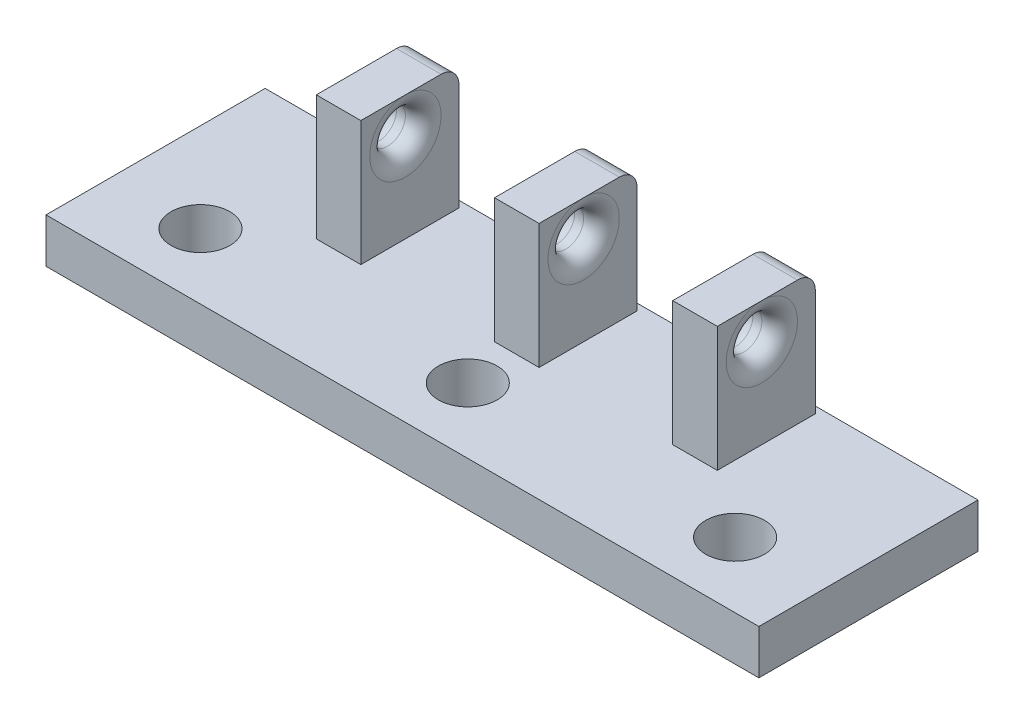
from build123d import *

# Parameters (mm, degrees)
SKETCH1_W           = 40
SKETCH1_H           = 29.333333334
SKETCH1_R           = 1.65
BOSS_EXTRUDE1_DEPTH = 2.5
SKETCH2_W           = 2.5
SKETCH2_H           = 5.5
BOSS_EXTRUDE2_DEPTH = 7
CUT_EXTRUDE1_REACH  = 37.804
SKETCH3_R           = 1
FILLET1_R           = 1
FILLET2_R           = 1
CUT_EXTRUDE2_REACH  = 27.77
SKETCH4_W           = 40
SKETCH4_H           = 17.038815724


with BuildPart() as part:
    # Sketch1 → Boss-Extrude1 (new body)
    with BuildSketch(Plane(origin=(0, 0, 0), x_dir=(1, 0, 0), z_dir=(0, 1, 0))):
        Rectangle(SKETCH1_W, SKETCH1_H)
        with Locations(Location((-15, 11, 0), (0, 0, 270))):
            Circle(SKETCH1_R, mode=Mode.SUBTRACT)
        with Locations(Location((0, 11, 0), (0, 0, 270))):
            Circle(SKETCH1_R, mode=Mode.SUBTRACT)
        with Locations(Location((15, 11, 0), (0, 0, 270))):
            Circle(SKETCH1_R, mode=Mode.SUBTRACT)
        with Locations(Location((0, 0, 0), (0, 0, 270))):
            Circle(SKETCH1_R, mode=Mode.SUBTRACT)
        with Locations(Location((15, 0, 0), (0, 0, 270))):
            Circle(SKETCH1_R, mode=Mode.SUBTRACT)
        with Locations(Location((0, -11, 0), (0, 0, 270))):
            Circle(SKETCH1_R, mode=Mode.SUBTRACT)
        with Locations(Location((15, -11, 0), (0, 0, 270))):
            Circle(SKETCH1_R, mode=Mode.SUBTRACT)
        with Locations(Location((-15, 0, 0), (0, 0, 270))):
            Circle(SKETCH1_R, mode=Mode.SUBTRACT)
        with Locations(Location((-15, -11, 0), (0, 0, 270))):
            Circle(SKETCH1_R, mode=Mode.SUBTRACT)
    extrude(amount=BOSS_EXTRUDE1_DEPTH)

    # Sketch2 → Boss-Extrude2 (add)
    with BuildSketch(Plane(origin=(0, 2.5, 0), x_dir=(1, 0, 0), z_dir=(0, 1, 0))):
        with Locations((10, -5.5)):
            Rectangle(SKETCH2_W, SKETCH2_H)
        with Locations((0, -5.5)):
            Rectangle(SKETCH2_W, SKETCH2_H)
        with Locations((-10, -5.5)):
            Rectangle(SKETCH2_W, SKETCH2_H)
    extrude(amount=BOSS_EXTRUDE2_DEPTH)

    # Cut-Extrude1: up to this face of the body (flat: up to its plane)
    cut_extrude1_end = Plane(part.part.faces().sort_by_distance((-11.25, 6, 5.5))[0])
    # Sketch3 → Cut-Extrude1 (cut, up to the picked face)
    with BuildSketch(Plane(origin=(11.25, 0, 0), x_dir=(0, 0, -1), z_dir=(1, 0, 0)), mode=Mode.PRIVATE) as cut_extrude1_sk1:
        with Locations((-5.75, 7.5)):
            Circle(SKETCH3_R)
    cut_extrude1_tool1 = split(extrude(cut_extrude1_sk1.sketch, amount=-CUT_EXTRUDE1_REACH, mode=Mode.PRIVATE), bisect_by=cut_extrude1_end, keep=Keep.BOTH, mode=Mode.PRIVATE)
    add(cut_extrude1_tool1.solids().sort_by(Axis((11.25, 7.5, 5.75), (-1, 0, 0)))[0], mode=Mode.SUBTRACT)

    # Fillet1
    fillet1_edges = [part.edges().sort_by_distance(p)[0] for p in [
        (-1.25, 7.5, 6.75),
        (1.25, 7.5, 6.75),
        (8.75, 7.5, 6.75),
        (-8.75, 7.5, 6.75),
        (11.25, 7.5, 6.75),
        (-11.25, 7.5, 6.75),
    ]]
    fillet(fillet1_edges, radius=FILLET1_R - 0.0001)  # a hair under: the kernel refuses the full size

    # Fillet2
    fillet2_edges = [part.edges().sort_by_distance(p)[0] for p in [
        (0, 9.5, 2.75),
        (10, 9.5, 2.75),
        (-10, 9.5, 2.75),
    ]]
    fillet(fillet2_edges, radius=FILLET2_R)

    # Sketch4 → Cut-Extrude2 (cut, up to next)
    with BuildSketch(Plane(origin=(0, 2.5, 0), x_dir=(1, 0, 0), z_dir=(0, 1, 0)), mode=Mode.PRIVATE) as cut_extrude2_sk1:
        with Locations((0, 6.147258805)):
            Rectangle(SKETCH4_W, SKETCH4_H)
    cut_extrude2_tool1 = extrude(cut_extrude2_sk1.sketch, amount=-CUT_EXTRUDE2_REACH, mode=Mode.PRIVATE) & part.part
    add(cut_extrude2_tool1.solids().sort_by_distance((0, 2.5, -6.147259))[0], mode=Mode.SUBTRACT)


solid = part.part
